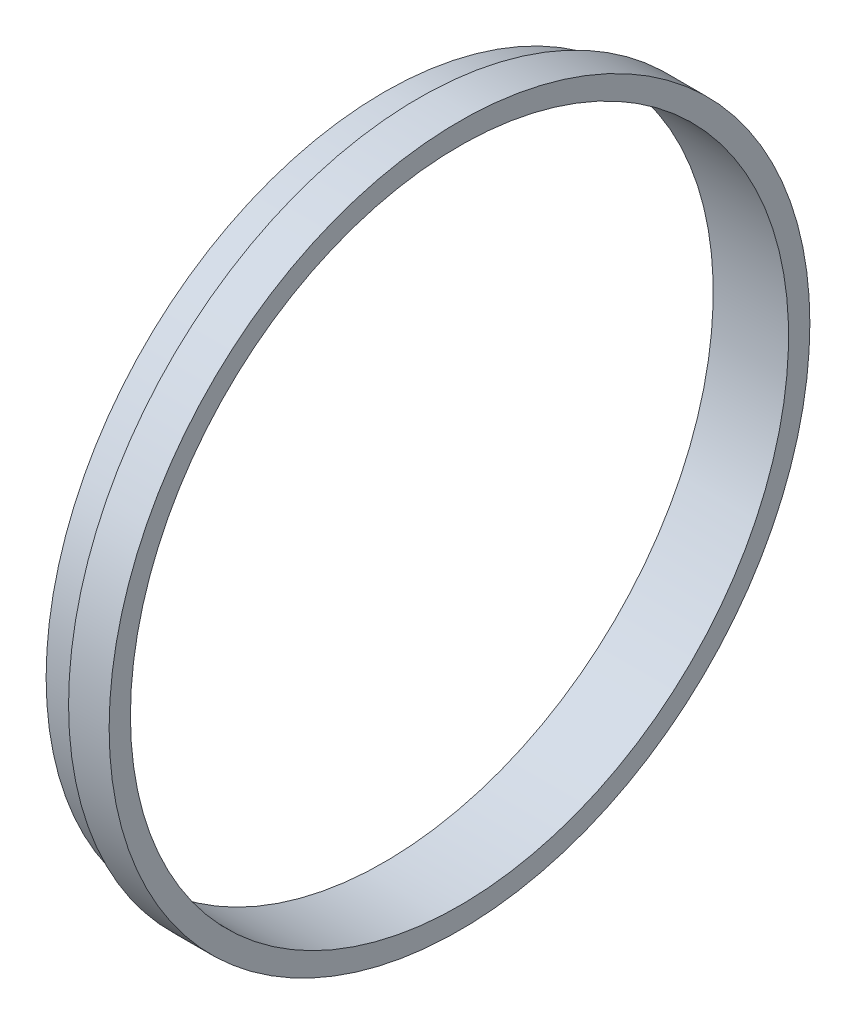
from build123d import *


with BuildPart() as part:
    # Sketch2 → Revolve1 (revolve)
    with BuildSketch(Plane.XY):
        Polygon((0, 145.226985009), (33.25, 145.226985009), (33.25, 154.626985009), (15.35, 154.626985009), (15.35, 151.901985009), (20.15, 151.901985009), (20.15, 149.176985009), (0, 149.176985009), align=None)
    revolve(axis=Axis((-72.365, 0, 0), (1, 0, 0)))


solid = part.part
